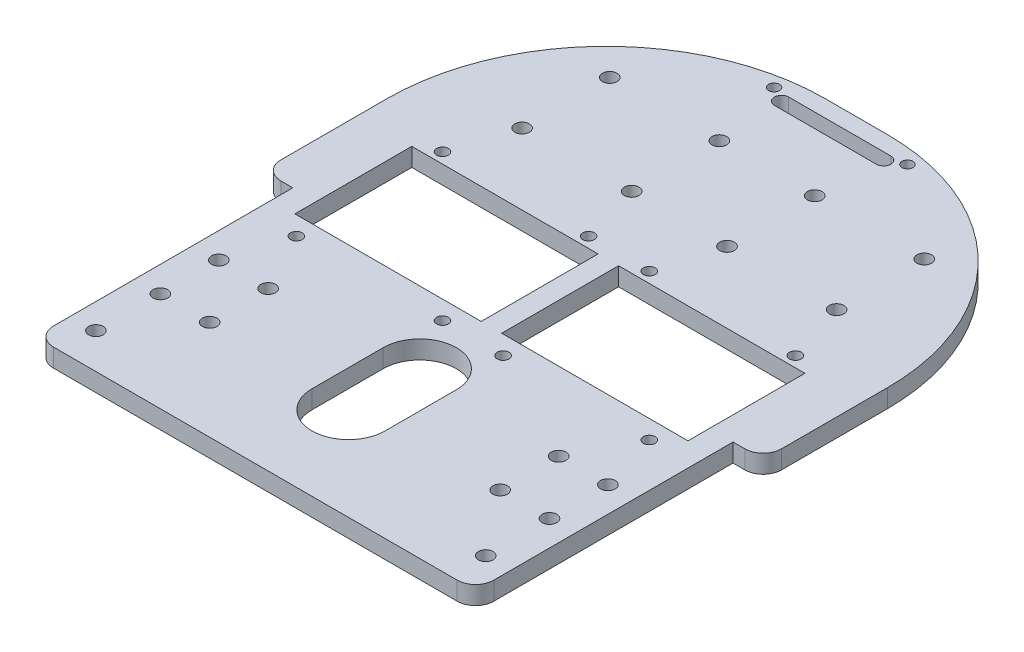
from build123d import *

# Parameters (mm, degrees)
BOSS_EXTRUDE2_DEPTH = 5
FILLET8_R           = 60
SKETCH4_R           = 2
SKETCH4_R_2         = 1.605
SKETCH4_R_3         = 1.5
SKETCH4_W           = 51
SKETCH4_H           = 32
CUT_EXTRUDE1_DEPTH  = 5
FILLET17_R          = 5


with BuildPart() as part:
    # Sketch1 → Boss-Extrude2 (new body)
    with BuildSketch(Plane(origin=(0, 0, 0), x_dir=(1, 0, 0), z_dir=(0, 1, 0))):
        Polygon((68.5, 80), (-68.5, 80), (-68.5, -14), (-60.25, -14), (-60.25, -84.5), (60.25, -84.5), (60.25, -14), (68.5, -14), align=None)
    extrude(amount=BOSS_EXTRUDE2_DEPTH)

    # Fillet8
    fillet8_edges = [part.edges().sort_by_distance(p)[0] for p in [
        (68.5, 2.5, -80),
        (-68.5, 2.5, -80),
    ]]
    fillet(fillet8_edges, radius=FILLET8_R)

    # Sketch4 → Cut-Extrude1 (cut)
    with BuildSketch(Plane(origin=(0, 5, 0), x_dir=(1, 0, 0), z_dir=(0, 1, 0))):
        with Locations((-39.75, -41.25)):
            Circle(SKETCH4_R)
        with Locations((39.75, -41.25)):
            Circle(SKETCH4_R)
        with Locations((39.75, -57.25)):
            Circle(SKETCH4_R)
        with Locations((-39.75, -57.25)):
            Circle(SKETCH4_R)
        with Locations((-53.25, -41.25)):
            Circle(SKETCH4_R)
        with Locations((-53.25, -57.25)):
            Circle(SKETCH4_R)
        with Locations((53.25, -57.25)):
            Circle(SKETCH4_R)
        with Locations((53.25, -41.25)):
            Circle(SKETCH4_R)
        with Locations((-48.298883815, 15.012633239)):
            Circle(SKETCH4_R_2)
        with Locations((-8.298883815, 15.012633239)):
            Circle(SKETCH4_R_2)
        with Locations((-48.298883815, -24.987366761)):
            Circle(SKETCH4_R_2)
        with Locations((-8.298883815, -24.987366761)):
            Circle(SKETCH4_R_2)
        with Locations((48.298883815, -24.987366761)):
            Circle(SKETCH4_R_2)
        with Locations((8.298883815, -24.987366761)):
            Circle(SKETCH4_R_2)
        with Locations((8.298883815, 15.012633239)):
            Circle(SKETCH4_R_2)
        with Locations((48.298883815, 15.012633239)):
            Circle(SKETCH4_R_2)
        with Locations((13.047144734, 55.54428083)):
            Circle(SKETCH4_R)
        with Locations((43.047144734, 55.54428083)):
            Circle(SKETCH4_R)
        with Locations((43.047144734, 31.54428083)):
            Circle(SKETCH4_R)
        with Locations((13.047144734, 31.54428083)):
            Circle(SKETCH4_R)
        with Locations((-43.047144734, 55.54428083)):
            Circle(SKETCH4_R)
        with Locations((-43.047144734, 31.54428083)):
            Circle(SKETCH4_R)
        with Locations((-13.047144734, 31.54428083)):
            Circle(SKETCH4_R)
        with Locations((-13.047144734, 55.54428083)):
            Circle(SKETCH4_R)
        with Locations((-18.180285112, 75.652692178)):
            Circle(SKETCH4_R_3)
        with Locations((18.319714888, 75.652692178)):
            Circle(SKETCH4_R_3)
        with Locations((-53.349046458, -74.796312774)):
            Circle(SKETCH4_R)
        with Locations((53.349046458, -74.796312774)):
            Circle(SKETCH4_R)
        with BuildLine():
            Line((10, -39.5), (10, -59))
            ThreePointArc((10, -59), (0, -69), (-10, -59))
            Line((-10, -59), (-10, -39.5))
            ThreePointArc((-10, -39.5), (0, -29.5), (10, -39.5))
        make_face()
        with Locations((-28.298883815, -3.887366761)):
            Rectangle(SKETCH4_W, SKETCH4_H)
        with Locations((28.298883815, -3.887366761)):
            Rectangle(SKETCH4_W, SKETCH4_H)
        with BuildLine():
            Line((-13.900285112, 75.389960782), (14.039714888, 75.389960782))
            ThreePointArc((14.039714888, 75.389960782), (16.006983492, 73.422692178), (14.039714888, 71.455423574))
            Line((14.039714888, 71.455423574), (-13.900285112, 71.455423574))
            ThreePointArc((-13.900285112, 71.455423574), (-15.867553716, 73.422692178), (-13.900285112, 75.389960782))
        make_face()
    extrude(amount=-CUT_EXTRUDE1_DEPTH, mode=Mode.SUBTRACT)

    # Fillet17
    fillet17_edges = [part.edges().sort_by_distance(p)[0] for p in [
        (68.5, 2.5, 14),
        (60.25, 2.5, 84.5),
        (-60.25, 2.5, 84.5),
        (-68.5, 2.5, 14),
    ]]
    fillet(fillet17_edges, radius=FILLET17_R)


solid = part.part
